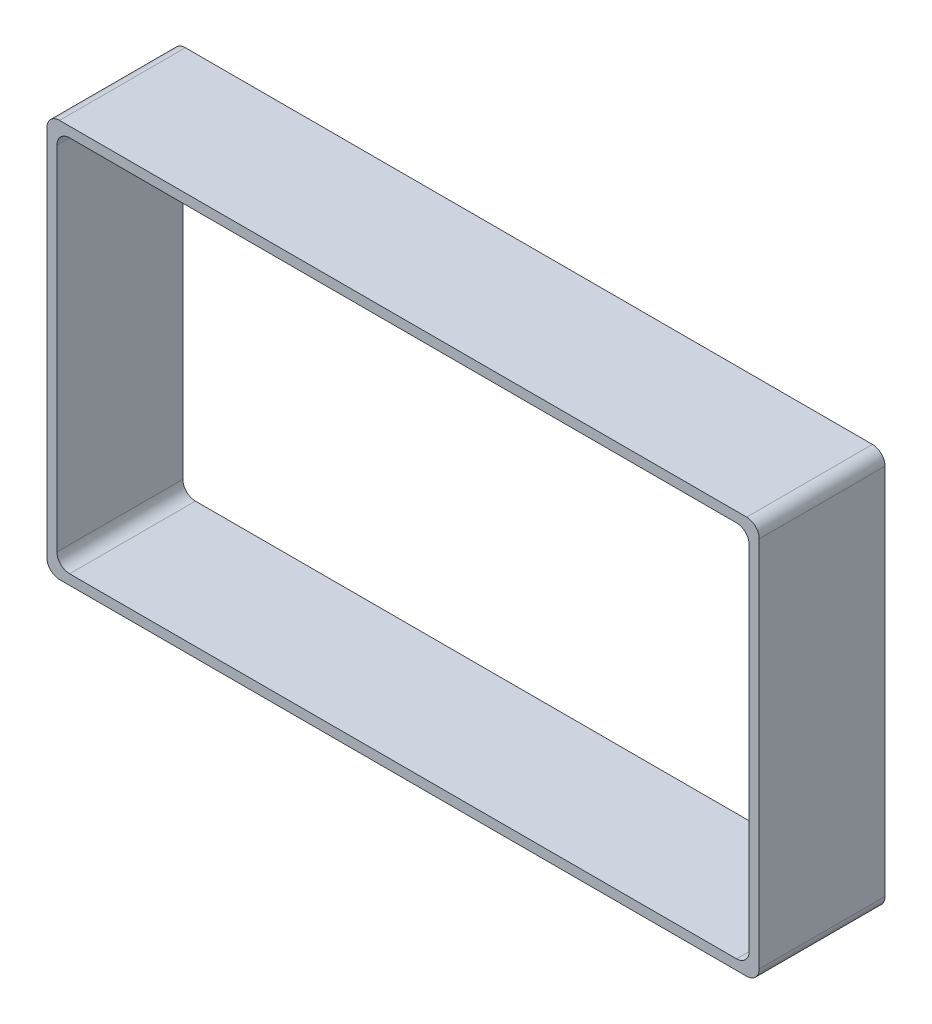
from build123d import *

# Parameters (mm, degrees)
ESQUISSE1_W        = 56.6
ESQUISSE1_H        = 31.6
ESQUISSE1_W_2      = 55
ESQUISSE1_H_2      = 30
BOSS_EXTRU_1_DEPTH = 10
CONG_1_R           = 1


with BuildPart() as part:
    # Esquisse1 → Boss.-Extru.1 (new body)
    with BuildSketch(Plane.XY):
        Rectangle(ESQUISSE1_W, ESQUISSE1_H)
        Rectangle(ESQUISSE1_W_2, ESQUISSE1_H_2, mode=Mode.SUBTRACT)
    extrude(amount=BOSS_EXTRU_1_DEPTH)

    # Congé1
    cong_1_edges = [part.edges().sort_by_distance(p)[0] for p in [
        (-27.5, 15, 5),
        (-27.5, -15, 5),
        (27.5, -15, 5),
        (27.5, 15, 5),
        (28.3, -15.8, 5),
        (-28.3, -15.8, 5),
        (-28.3, 15.8, 5),
        (28.3, 15.8, 5),
    ]]
    fillet(cong_1_edges, radius=CONG_1_R)


solid = part.part
